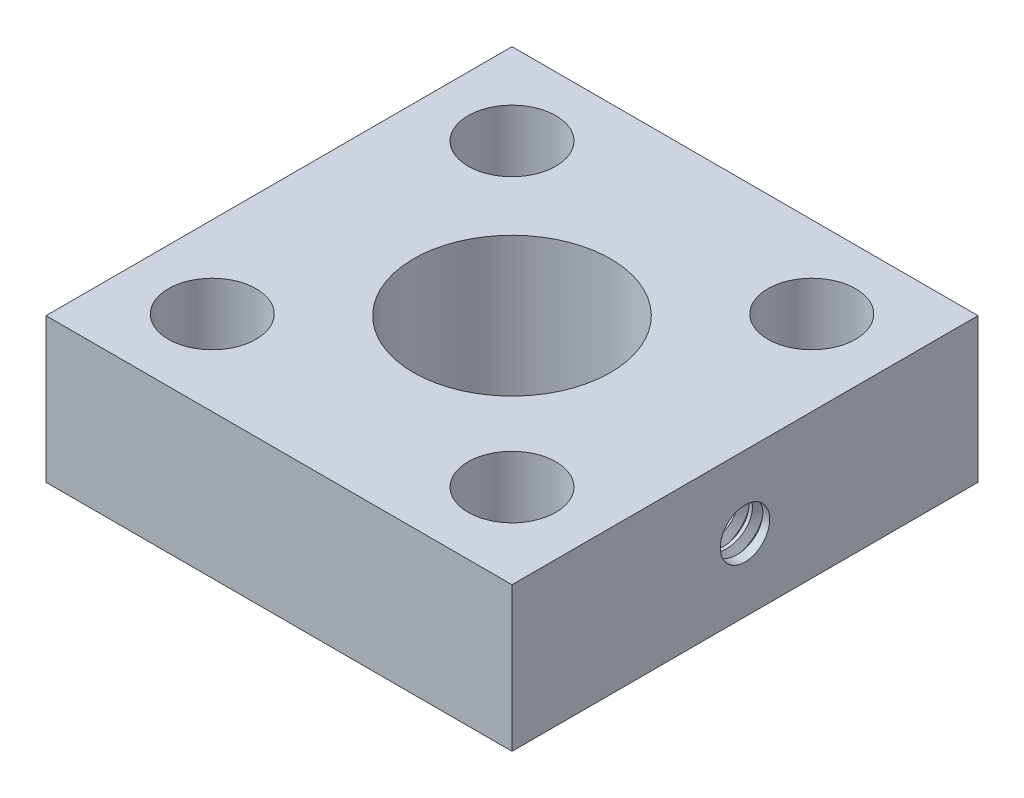
from build123d import *
from build123d.topology import SkipClean

# Parameters (mm, degrees)
BOSS_EXTRUDE1_DEPTH      = 3.302
BOSS_EXTRUDE1_DEPTH_BACK = 3.302
SKETCH1_W                = 21.323004076
SKETCH1_H                = 21.323004076
SKETCH1_R                = 4.5085
SKETCH1_R_2              = 2.0066
CUT_EXTRUDE2_REACH       = 26.067
CUT_EXTRUDE2_END_RADIUS  = 4.5085
SKETCH12_R               = 1.1303
THREAD2_PITCH            = 0.635


with BuildPart() as part:
    # Sketch1 → Boss-Extrude1 (new, two sides: drawn at the far end of the back side and taken through both)
    with BuildSketch(Plane(origin=(0, 0, 0), x_dir=(1, 0, 0), z_dir=(0, 1, 0)).offset(-BOSS_EXTRUDE1_DEPTH_BACK)):
        Rectangle(SKETCH1_W, SKETCH1_H)
        with Locations(Location((0, 0, 0), (0, 0, 270))):
            Circle(SKETCH1_R, mode=Mode.SUBTRACT)
        with Locations(Location((-6.92474648, 6.92474648, 0), (0, 0, 270))):
            Circle(SKETCH1_R_2, mode=Mode.SUBTRACT)
        with Locations(Location((6.79125352, 6.92474648, 0), (0, 0, 270))):
            Circle(SKETCH1_R_2, mode=Mode.SUBTRACT)
        with Locations(Location((6.79125352, -6.79125352, 0), (0, 0, 270))):
            Circle(SKETCH1_R_2, mode=Mode.SUBTRACT)
        with Locations(Location((-6.92474648, -6.79125352, 0), (0, 0, 270))):
            Circle(SKETCH1_R_2, mode=Mode.SUBTRACT)
    extrude(amount=BOSS_EXTRUDE1_DEPTH + BOSS_EXTRUDE1_DEPTH_BACK)

    # Cut-Extrude2: up to this cylinder (the profile starts outside it)
    cut_extrude2_end = Plane(origin=(0, 0, 0), z_dir=(0, 1, 0)) * Cylinder(CUT_EXTRUDE2_END_RADIUS, 62.151, mode=Mode.PRIVATE)
    # Sketch12 → Cut-Extrude2 (cut, up to the surface)
    with BuildSketch(Plane(origin=(10.661502038, 0, 0), x_dir=(0, 0, -1), z_dir=(1, 0, 0)), mode=Mode.PRIVATE) as cut_extrude2_sk1:
        Circle(SKETCH12_R)
    cut_extrude2_tool1 = extrude(cut_extrude2_sk1.sketch, amount=-CUT_EXTRUDE2_REACH, mode=Mode.PRIVATE) - cut_extrude2_end
    add(cut_extrude2_tool1.solids().sort_by_distance((10.661502, 0, 0))[0], mode=Mode.SUBTRACT)

    # Thread2: the profile of Thread Profile3 profile screwed along a right-hand helix of 15.748031 turns, 6 arcs to a turn; built about Z, then put on its axis
    with SkipClean():  # the faces are left unmerged after this step: merging them gives an invalid solid
        thread2_z = Axis((0, 0, 0), (0, 0, 1))
        thread2_corners = [(1.13, 0, -0.000173205), (1.474003831, 0, 0.198437499), (1.474003831, 0, 0.277812499), (1.13, 0, 0.476423204)]
        with BuildLine(mode=Mode.PRIVATE) as thread2_profile:
            Line(thread2_corners[0], thread2_corners[1])
            Line(thread2_corners[1], thread2_corners[2])
            Line(thread2_corners[2], thread2_corners[3])
            Line(thread2_corners[3], thread2_corners[0])
        thread2_cap = Face(thread2_profile.wire())
        thread2_turn_angles = [0, 30, 60, 90, 120, 150, 180, 210, 240, 270, 300, 330, 360]
        thread2_turn_weights = [1, 0.8660254037844387, 1, 0.8660254037844387, 1, 0.8660254037844387, 1, 0.8660254037844387, 1, 0.8660254037844387, 1, 0.8660254037844387, 1]
        thread2_turn_rails = [Edge.make_bspline([Vector(p[0], p[1], 0).rotate(thread2_z, thread2_turn_angles[k]) / thread2_turn_weights[k] + Vector(0, 0, p[2] + THREAD2_PITCH * thread2_turn_angles[k] / 360) for k in range(13)], [0, 0, 0, 1, 1, 2, 2, 3, 3, 4, 4, 5, 5, 6, 6, 6], 2, thread2_turn_weights) for p in thread2_corners]
        thread2_turn_sides = [Face.make_surface_from_curves(thread2_turn_rails[p[0]], thread2_turn_rails[p[1]]) for p in [(0, 1), (1, 2), (2, 3), (3, 0)]]
        thread2_last_angles = [5400, 5430, 5460, 5490, 5520, 5550, 5580, 5610, 5640, 5654.645669291, 5669.291338583]
        thread2_last_weights = [1, 0.8660254037844387, 1, 0.8660254037844387, 1, 0.8660254037844387, 1, 0.8660254037844387, 1, 0.9675079437748935, 1]
        thread2_last_rails = [Edge.make_bspline([Vector(p[0], p[1], 0).rotate(thread2_z, thread2_last_angles[k]) / thread2_last_weights[k] + Vector(0, 0, p[2] + THREAD2_PITCH * thread2_last_angles[k] / 360) for k in range(11)], [0, 0, 0, 1, 1, 2, 2, 3, 3, 4, 4, 5, 5, 5], 2, thread2_last_weights) for p in thread2_corners]
        thread2_last_sides = [Face.make_surface_from_curves(thread2_last_rails[p[0]], thread2_last_rails[p[1]]) for p in [(0, 1), (1, 2), (2, 3), (3, 0)]]
        thread2 = Plane(origin=(10.661502038, 0, 0), x_dir=(0, 0, 1), z_dir=(-1, 0, 0)) * Solid(Shell([*[p.moved(Location((0, 0, THREAD2_PITCH * i))) for i in range(15) for p in thread2_turn_sides], *thread2_last_sides, thread2_cap, thread2_cap.rotate(thread2_z, 5669.291338583).moved(Location((0, 0, THREAD2_PITCH * 5669.291338583 / 360)))]))
        add(thread2, mode=Mode.SUBTRACT)


solid = part.part
